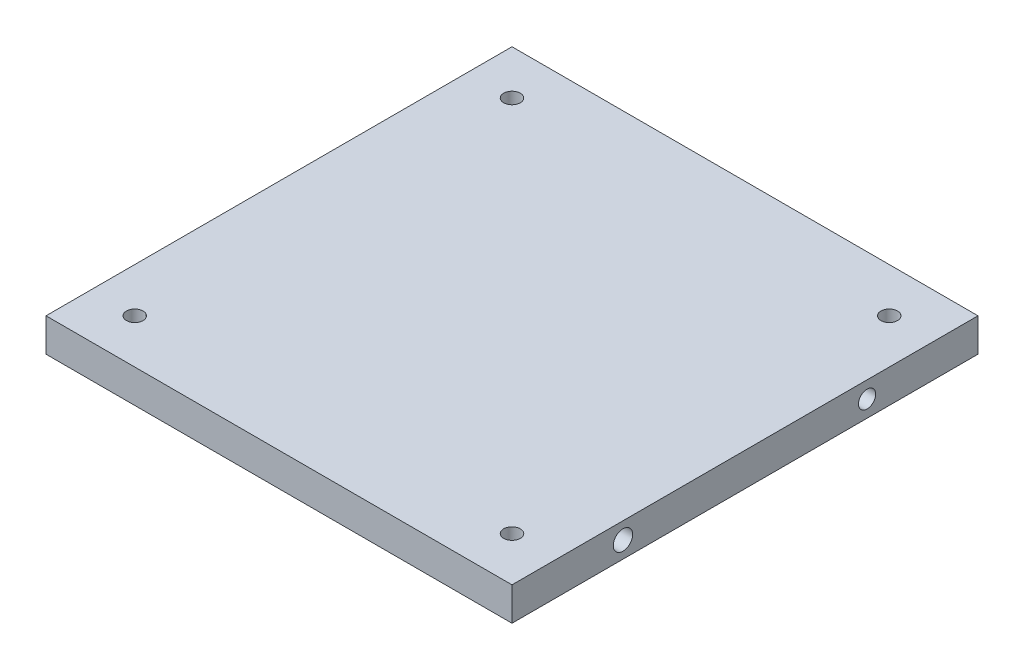
from build123d import *

# Parameters (mm, degrees)
SKETCH1_W            = 84
SKETCH1_H            = 84
BOSS_EXTRUDE1_DEPTH  = 6
SKETCH2_R            = 1.5
CUT_EXTRUDE1_DEPTH   = 6
LPATTERN1_COUNT      = 2
LPATTERN1_PITCH      = 68
LPATTERN1_COUNT_DIR2 = 2
LPATTERN1_PITCH_DIR2 = 68
SKETCH3_R            = 1.549904247
SKETCH3_R_2          = 1.748244363
CUT_EXTRUDE2_DEPTH   = 10


with BuildPart() as part:
    # Sketch1 → Boss-Extrude1 (new body)
    with BuildSketch(Plane(origin=(0, 0, 0), x_dir=(1, 0, 0), z_dir=(0, 1, 0))):
        with Locations((42, 42)):
            Rectangle(SKETCH1_W, SKETCH1_H)
    extrude(amount=BOSS_EXTRUDE1_DEPTH)

    # Sketch2 → Cut-Extrude1 (cut)
    with BuildSketch(Plane(origin=(0, 6, 0), x_dir=(1, 0, 0), z_dir=(0, 1, 0))):
        with Locations((8, 76)):
            Circle(SKETCH2_R)
    cut_extrude1 = extrude(amount=-CUT_EXTRUDE1_DEPTH, mode=Mode.SUBTRACT)

    # LPattern1: Cut-Extrude1 2 × 2
    with Locations(*[(i * LPATTERN1_PITCH, 0, j * LPATTERN1_PITCH_DIR2) for i in range(LPATTERN1_COUNT) for j in range(LPATTERN1_COUNT_DIR2) if (i, j) != (0, 0)]):
        add(cut_extrude1, mode=Mode.SUBTRACT)

    # Sketch3 → Cut-Extrude2 (cut)
    with BuildSketch(Plane.ZY):
        with Locations((-64, 3)):
            Circle(SKETCH3_R)
        with Locations((-20, 3)):
            Circle(SKETCH3_R_2)
    cut_extrude2 = extrude(amount=-CUT_EXTRUDE2_DEPTH, mode=Mode.SUBTRACT)

    # Mirror1: Cut-Extrude2 across plane
    add(cut_extrude2.mirror(Plane.ZY.offset(-42)), mode=Mode.SUBTRACT)


solid = part.part
